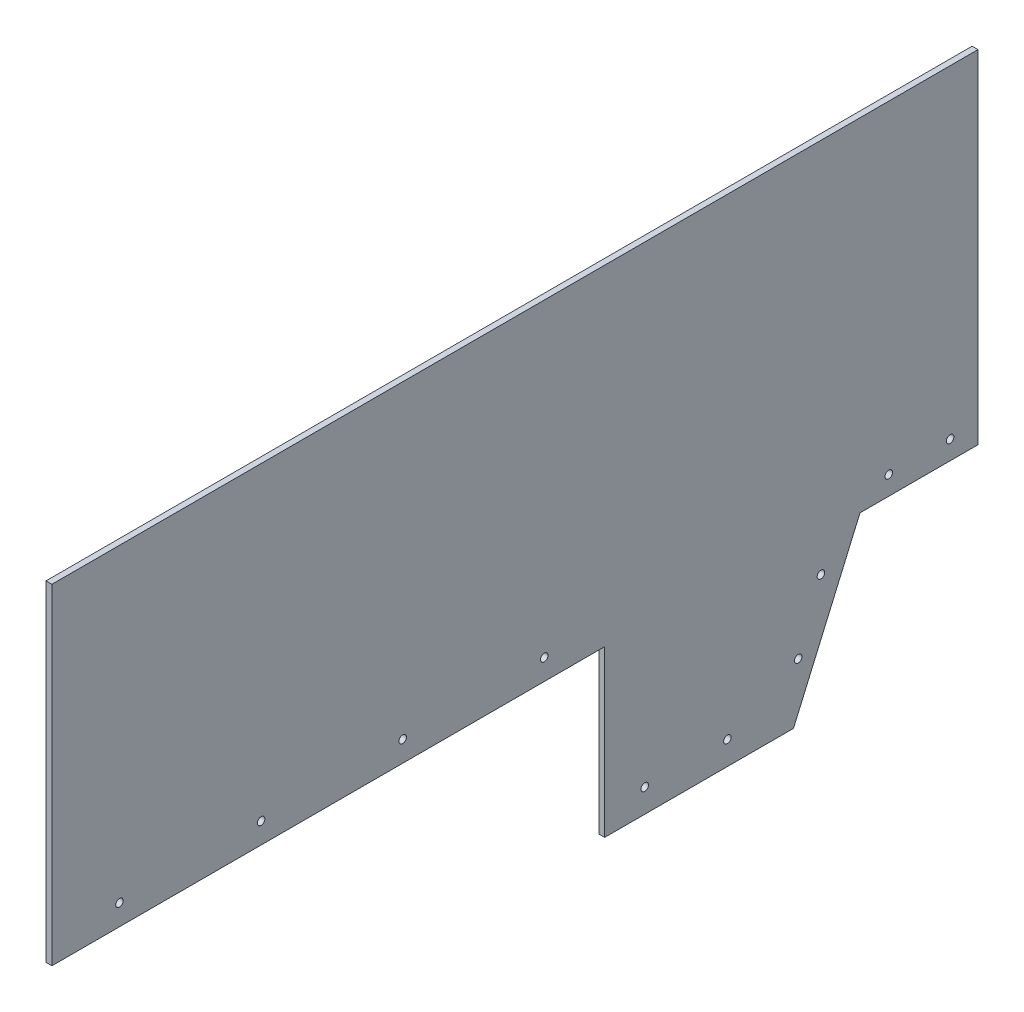
from build123d import *

# Parameters (mm, degrees)
SKETCH1_W           = 498.348
SKETCH1_H           = 177.8
BOSS_EXTRUDE1_DEPTH = 1.5875
BOSS_EXTRUDE2_DEPTH = 3.175
SKETCH3_R           = 2.025
CUT_EXTRUDE1_DEPTH  = 307.121875894
LPATTERN1_COUNT     = 4
LPATTERN1_PITCH     = 76.2
SKETCH4_R           = 2.025
CUT_EXTRUDE2_DEPTH  = 307.121875894
LPATTERN2_COUNT     = 2
LPATTERN2_PITCH     = 44.45
CUT_EXTRUDE3_DEPTH  = 307.121875894
CUT_EXTRUDE5_DEPTH  = 307.121875894
CUT_EXTRUDE6_DEPTH  = 307.121875894
LPATTERN4_COUNT     = 2
LPATTERN4_PITCH     = 33.02


with BuildPart() as part:
    # Sketch1 → Boss-Extrude1 (new, symmetric)
    with BuildSketch(Plane(origin=(0, 0, 0), x_dir=(0, 0, -1), z_dir=(1, 0, 0))):
        Rectangle(SKETCH1_W, SKETCH1_H)
    extrude(amount=BOSS_EXTRUDE1_DEPTH, both=True)

    # Sketch2 → Boss-Extrude2 (add)
    with BuildSketch(Plane(origin=(1.5875, 0, 0), x_dir=(0, 0, -1), z_dir=(1, 0, 0))):
        Polygon((249.174, -95.25), (249.174, -88.9), (48.2854, -88.9), (48.2854, -177.8), (149.8854, -177.8), (185.674, -95.25), align=None)
    extrude(amount=-BOSS_EXTRUDE2_DEPTH)

    # Sketch3 → Cut-Extrude1 (cut, through all)
    with BuildSketch(Plane(origin=(1.5875, 0, 0), x_dir=(0, 0, -1), z_dir=(1, 0, 0))):
        with Locations((15.7854, -77.70635352)):
            Circle(SKETCH3_R)
    cut_extrude1 = extrude(amount=-CUT_EXTRUDE1_DEPTH, mode=Mode.SUBTRACT)

    # LPattern1: Cut-Extrude1 ×4
    with Locations(*[(0, 0, i * LPATTERN1_PITCH) for i in range(1, LPATTERN1_COUNT)]):
        add(cut_extrude1, mode=Mode.SUBTRACT)

    # Sketch4 → Cut-Extrude2 (cut, through all)
    with BuildSketch(Plane.ZY.offset(1.5875)):
        with Locations((-69.8754, -165.1)):
            Circle(SKETCH4_R)
    cut_extrude2 = extrude(amount=-CUT_EXTRUDE2_DEPTH, mode=Mode.SUBTRACT)

    # LPattern2: Cut-Extrude2 ×2
    with Locations(*[(0, 0, -i * LPATTERN2_PITCH) for i in range(1, LPATTERN2_COUNT)]):
        add(cut_extrude2, mode=Mode.SUBTRACT)

    # Sketch5 → Cut-Extrude3 (cut, through all)
    with BuildSketch(Plane.ZY.offset(1.5875)):
        with BuildLine():
            ThreePointArc((-154.258101559, -147.389909043), (-151.988878514, -148.567220935), (-150.375190485, -146.584433135))
            ThreePointArc((-150.375190485, -146.584433135), (-152.811502455, -144.601645334), (-154.258101559, -147.389909043))
        make_face()
    extrude(amount=-CUT_EXTRUDE3_DEPTH, mode=Mode.SUBTRACT)

    # Sketch8 → Cut-Extrude5 (cut, through all)
    with BuildSketch(Plane.ZY.offset(1.5875)):
        with BuildLine():
            ThreePointArc((-166.505255373, -114.283933276), (-164.235511828, -115.455381337), (-162.624641131, -113.473180055))
            ThreePointArc((-162.624641131, -113.473180055), (-165.063770434, -111.490978774), (-166.505255373, -114.283933276))
        make_face()
    extrude(amount=-CUT_EXTRUDE5_DEPTH, mode=Mode.SUBTRACT)

    # Sketch9 → Cut-Extrude6 (cut, through all)
    with BuildSketch(Plane.ZY.offset(1.5875)):
        with BuildLine():
            ThreePointArc((-201.170653386, -87.115), (-199.738762154, -86.521891232), (-199.145653386, -85.09))
            ThreePointArc((-199.145653386, -85.09), (-202.602544618, -83.658108768), (-201.170653386, -87.115))
        make_face()
    cut_extrude6 = extrude(amount=-CUT_EXTRUDE6_DEPTH, mode=Mode.SUBTRACT)

    # LPattern4: Cut-Extrude6 ×2
    with Locations(*[(0, 0, -i * LPATTERN4_PITCH) for i in range(1, LPATTERN4_COUNT)]):
        add(cut_extrude6, mode=Mode.SUBTRACT)


solid = part.part
